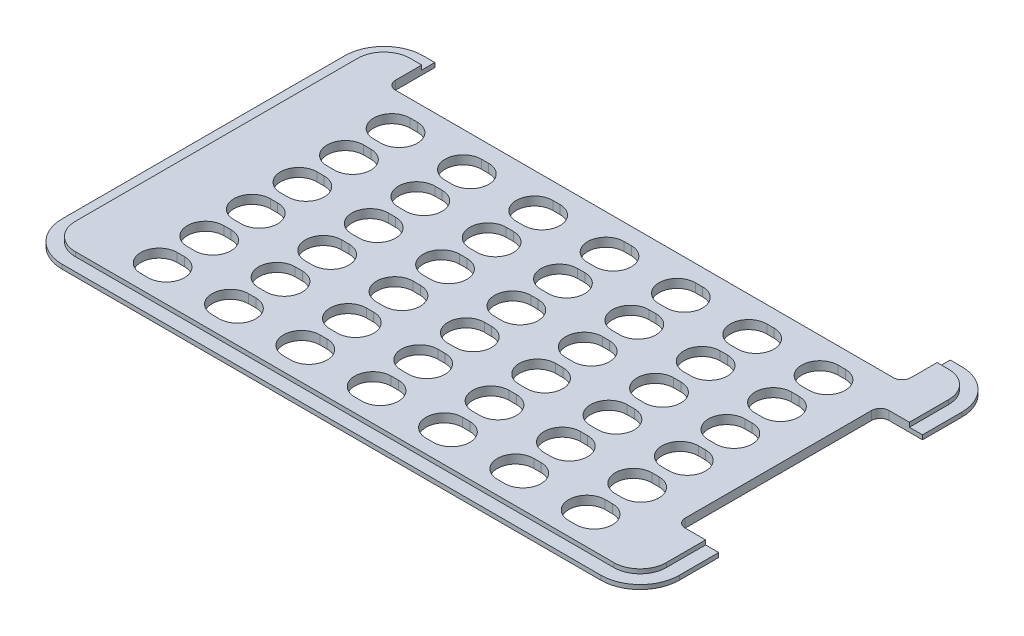
from build123d import *

# Parameters (mm, degrees)
SKETCH1_W                    = 212
SKETCH1_H                    = 124
OUTER_PROFILE_DEPTH          = 1.5
SKETCH2_W                    = 203
SKETCH2_H                    = 115
INNER_PROFILE_DEPTH          = 1.5
FILLET1_R                    = 9
FILLET2_R                    = 13.5
SKETCH4_W                    = 177
SKETCH4_H                    = 16.5
SKETCH4_W_2                  = 14.5
SKETCH4_H_2                  = 70
MESSAGE_BAR_DEPTH            = 123.837290755
CUTOUT_DEPTH                 = 123.837290755
CUTOUTS_COUNT                = 4
CUTOUTS_PITCH                = 24.5
CUTOUTS_COUNT_DIR2           = 6
CUTOUTS_PITCH_DIR2           = 16
MIRROR_CUTOUTS_COPY_1_DEPTH  = 123.837290755
MIRROR_CUTOUTS_COPY_2_DEPTH  = 123.837290755
MIRROR_CUTOUTS_COPY_3_DEPTH  = 123.837290755
MIRROR_CUTOUTS_COPY_4_DEPTH  = 123.837290755
MIRROR_CUTOUTS_COPY_5_DEPTH  = 123.837290755
MIRROR_CUTOUTS_COPY_6_DEPTH  = 123.837290755
MIRROR_CUTOUTS_COPY_7_DEPTH  = 123.837290755
MIRROR_CUTOUTS_COPY_8_DEPTH  = 123.837290755
MIRROR_CUTOUTS_COPY_9_DEPTH  = 123.837290755
MIRROR_CUTOUTS_COPY_10_DEPTH = 123.837290755
MIRROR_CUTOUTS_COPY_11_DEPTH = 123.837290755
MIRROR_CUTOUTS_COPY_12_DEPTH = 123.837290755
MIRROR_CUTOUTS_COPY_13_DEPTH = 123.837290755
MIRROR_CUTOUTS_COPY_14_DEPTH = 123.837290755
MIRROR_CUTOUTS_COPY_15_DEPTH = 123.837290755
MIRROR_CUTOUTS_COPY_16_DEPTH = 123.837290755
MIRROR_CUTOUTS_COPY_17_DEPTH = 123.837290755
MIRROR_CUTOUTS_COPY_18_DEPTH = 123.837290755
MIRROR_CUTOUTS_COPY_19_DEPTH = 123.837290755
MIRROR_CUTOUTS_COPY_20_DEPTH = 123.837290755
MIRROR_CUTOUTS_COPY_21_DEPTH = 123.837290755
MIRROR_CUTOUTS_COPY_22_DEPTH = 123.837290755
MIRROR_CUTOUTS_COPY_23_DEPTH = 123.837290755
MIRROR_CUTOUTS_COPY_24_DEPTH = 123.837290755
CORNER_RAD_R                 = 3


with BuildPart() as part:
    # Sketch1 → Outer Profile (new body)
    with BuildSketch(Plane(origin=(0, 0, 0), x_dir=(1, 0, 0), z_dir=(0, 1, 0))):
        Rectangle(SKETCH1_W, SKETCH1_H)
    extrude(amount=OUTER_PROFILE_DEPTH)

    # Sketch2 → Inner Profile (add)
    with BuildSketch(Plane(origin=(0, 1.5, 0), x_dir=(1, 0, 0), z_dir=(0, 1, 0))):
        Rectangle(SKETCH2_W, SKETCH2_H)
    extrude(amount=INNER_PROFILE_DEPTH)

    # Fillet1
    fillet1_edges = [part.edges().sort_by_distance(p)[0] for p in [
        (101.5, 2.25, 57.5),
        (101.5, 2.25, -57.5),
        (-101.5, 2.25, -57.5),
        (-101.5, 2.25, 57.5),
    ]]
    fillet(fillet1_edges, radius=FILLET1_R)

    # Fillet2
    fillet2_edges = [part.edges().sort_by_distance(p)[0] for p in [
        (-106, 0.75, -62),
        (106, 0.75, -62),
        (106, 0.75, 62),
        (-106, 0.75, 62),
    ]]
    fillet(fillet2_edges, radius=FILLET2_R)

    # Sketch4 → Message Bar (cut, through all)
    with BuildSketch(Plane(origin=(0, 3, 0), x_dir=(1, 0, 0), z_dir=(0, 1, 0))):
        with Locations((0, 53.75)):
            Rectangle(SKETCH4_W, SKETCH4_H)
        with Locations((98.75, 0)):
            Rectangle(SKETCH4_W_2, SKETCH4_H_2)
    extrude(amount=-MESSAGE_BAR_DEPTH, mode=Mode.SUBTRACT)

    # Sketch5 → Cutout (cut, through all)
    with BuildSketch(Plane(origin=(0, 3, 0), x_dir=(1, 0, 0), z_dir=(0, 1, 0))):
        with BuildLine():
            Line((-1.25, -40.25), (1.25, -40.25))
            ThreePointArc((1.25, -40.25), (7.5, -46.5), (1.25, -52.75))
            Line((1.25, -52.75), (-1.25, -52.75))
            ThreePointArc((-1.25, -52.75), (-7.5, -46.5), (-1.25, -40.25))
        make_face()
    cutout = extrude(amount=-CUTOUT_DEPTH, mode=Mode.SUBTRACT)

    # Cutouts: Cutout 4 × 6
    with Locations(*[(-i * CUTOUTS_PITCH, 0, -j * CUTOUTS_PITCH_DIR2) for i in range(CUTOUTS_COUNT) for j in range(CUTOUTS_COUNT_DIR2) if (i, j) != (0, 0)]):
        add(cutout, mode=Mode.SUBTRACT)

    # Mirror Cutouts copy 1 sketch → Mirror Cutouts copy 1 (cut, through all)
    with BuildSketch(Plane(origin=(0, 3, -16), x_dir=(-1, 0, 0), z_dir=(0, 1, 0))):
        with BuildLine():
            Line((-1.25, 40.25), (1.25, 40.25))
            ThreePointArc((1.25, 40.25), (7.5, 46.5), (1.25, 52.75))
            Line((1.25, 52.75), (-1.25, 52.75))
            ThreePointArc((-1.25, 52.75), (-7.5, 46.5), (-1.25, 40.25))
        make_face()
    extrude(amount=-MIRROR_CUTOUTS_COPY_1_DEPTH, mode=Mode.SUBTRACT)

    # Mirror Cutouts copy 2 sketch → Mirror Cutouts copy 2 (cut, through all)
    with BuildSketch(Plane(origin=(0, 3, -32), x_dir=(-1, 0, 0), z_dir=(0, 1, 0))):
        with BuildLine():
            Line((-1.25, 40.25), (1.25, 40.25))
            ThreePointArc((1.25, 40.25), (7.5, 46.5), (1.25, 52.75))
            Line((1.25, 52.75), (-1.25, 52.75))
            ThreePointArc((-1.25, 52.75), (-7.5, 46.5), (-1.25, 40.25))
        make_face()
    extrude(amount=-MIRROR_CUTOUTS_COPY_2_DEPTH, mode=Mode.SUBTRACT)

    # Mirror Cutouts copy 3 sketch → Mirror Cutouts copy 3 (cut, through all)
    with BuildSketch(Plane(origin=(0, 3, -48), x_dir=(-1, 0, 0), z_dir=(0, 1, 0))):
        with BuildLine():
            Line((-1.25, 40.25), (1.25, 40.25))
            ThreePointArc((1.25, 40.25), (7.5, 46.5), (1.25, 52.75))
            Line((1.25, 52.75), (-1.25, 52.75))
            ThreePointArc((-1.25, 52.75), (-7.5, 46.5), (-1.25, 40.25))
        make_face()
    extrude(amount=-MIRROR_CUTOUTS_COPY_3_DEPTH, mode=Mode.SUBTRACT)

    # Mirror Cutouts copy 4 sketch → Mirror Cutouts copy 4 (cut, through all)
    with BuildSketch(Plane(origin=(0, 3, -64), x_dir=(-1, 0, 0), z_dir=(0, 1, 0))):
        with BuildLine():
            Line((-1.25, 40.25), (1.25, 40.25))
            ThreePointArc((1.25, 40.25), (7.5, 46.5), (1.25, 52.75))
            Line((1.25, 52.75), (-1.25, 52.75))
            ThreePointArc((-1.25, 52.75), (-7.5, 46.5), (-1.25, 40.25))
        make_face()
    extrude(amount=-MIRROR_CUTOUTS_COPY_4_DEPTH, mode=Mode.SUBTRACT)

    # Mirror Cutouts copy 5 sketch → Mirror Cutouts copy 5 (cut, through all)
    with BuildSketch(Plane(origin=(0, 3, -80), x_dir=(-1, 0, 0), z_dir=(0, 1, 0))):
        with BuildLine():
            Line((-1.25, 40.25), (1.25, 40.25))
            ThreePointArc((1.25, 40.25), (7.5, 46.5), (1.25, 52.75))
            Line((1.25, 52.75), (-1.25, 52.75))
            ThreePointArc((-1.25, 52.75), (-7.5, 46.5), (-1.25, 40.25))
        make_face()
    extrude(amount=-MIRROR_CUTOUTS_COPY_5_DEPTH, mode=Mode.SUBTRACT)

    # Mirror Cutouts copy 6 sketch → Mirror Cutouts copy 6 (cut, through all)
    with BuildSketch(Plane(origin=(24.5, 3, 0), x_dir=(-1, 0, 0), z_dir=(0, 1, 0))):
        with BuildLine():
            Line((-1.25, 40.25), (1.25, 40.25))
            ThreePointArc((1.25, 40.25), (7.5, 46.5), (1.25, 52.75))
            Line((1.25, 52.75), (-1.25, 52.75))
            ThreePointArc((-1.25, 52.75), (-7.5, 46.5), (-1.25, 40.25))
        make_face()
    extrude(amount=-MIRROR_CUTOUTS_COPY_6_DEPTH, mode=Mode.SUBTRACT)

    # Mirror Cutouts copy 7 sketch → Mirror Cutouts copy 7 (cut, through all)
    with BuildSketch(Plane(origin=(24.5, 3, -16), x_dir=(-1, 0, 0), z_dir=(0, 1, 0))):
        with BuildLine():
            Line((-1.25, 40.25), (1.25, 40.25))
            ThreePointArc((1.25, 40.25), (7.5, 46.5), (1.25, 52.75))
            Line((1.25, 52.75), (-1.25, 52.75))
            ThreePointArc((-1.25, 52.75), (-7.5, 46.5), (-1.25, 40.25))
        make_face()
    extrude(amount=-MIRROR_CUTOUTS_COPY_7_DEPTH, mode=Mode.SUBTRACT)

    # Mirror Cutouts copy 8 sketch → Mirror Cutouts copy 8 (cut, through all)
    with BuildSketch(Plane(origin=(24.5, 3, -32), x_dir=(-1, 0, 0), z_dir=(0, 1, 0))):
        with BuildLine():
            Line((-1.25, 40.25), (1.25, 40.25))
            ThreePointArc((1.25, 40.25), (7.5, 46.5), (1.25, 52.75))
            Line((1.25, 52.75), (-1.25, 52.75))
            ThreePointArc((-1.25, 52.75), (-7.5, 46.5), (-1.25, 40.25))
        make_face()
    extrude(amount=-MIRROR_CUTOUTS_COPY_8_DEPTH, mode=Mode.SUBTRACT)

    # Mirror Cutouts copy 9 sketch → Mirror Cutouts copy 9 (cut, through all)
    with BuildSketch(Plane(origin=(24.5, 3, -48), x_dir=(-1, 0, 0), z_dir=(0, 1, 0))):
        with BuildLine():
            Line((-1.25, 40.25), (1.25, 40.25))
            ThreePointArc((1.25, 40.25), (7.5, 46.5), (1.25, 52.75))
            Line((1.25, 52.75), (-1.25, 52.75))
            ThreePointArc((-1.25, 52.75), (-7.5, 46.5), (-1.25, 40.25))
        make_face()
    extrude(amount=-MIRROR_CUTOUTS_COPY_9_DEPTH, mode=Mode.SUBTRACT)

    # Mirror Cutouts copy 10 sketch → Mirror Cutouts copy 10 (cut, through all)
    with BuildSketch(Plane(origin=(24.5, 3, -64), x_dir=(-1, 0, 0), z_dir=(0, 1, 0))):
        with BuildLine():
            Line((-1.25, 40.25), (1.25, 40.25))
            ThreePointArc((1.25, 40.25), (7.5, 46.5), (1.25, 52.75))
            Line((1.25, 52.75), (-1.25, 52.75))
            ThreePointArc((-1.25, 52.75), (-7.5, 46.5), (-1.25, 40.25))
        make_face()
    extrude(amount=-MIRROR_CUTOUTS_COPY_10_DEPTH, mode=Mode.SUBTRACT)

    # Mirror Cutouts copy 11 sketch → Mirror Cutouts copy 11 (cut, through all)
    with BuildSketch(Plane(origin=(24.5, 3, -80), x_dir=(-1, 0, 0), z_dir=(0, 1, 0))):
        with BuildLine():
            Line((-1.25, 40.25), (1.25, 40.25))
            ThreePointArc((1.25, 40.25), (7.5, 46.5), (1.25, 52.75))
            Line((1.25, 52.75), (-1.25, 52.75))
            ThreePointArc((-1.25, 52.75), (-7.5, 46.5), (-1.25, 40.25))
        make_face()
    extrude(amount=-MIRROR_CUTOUTS_COPY_11_DEPTH, mode=Mode.SUBTRACT)

    # Mirror Cutouts copy 12 sketch → Mirror Cutouts copy 12 (cut, through all)
    with BuildSketch(Plane(origin=(49, 3, 0), x_dir=(-1, 0, 0), z_dir=(0, 1, 0))):
        with BuildLine():
            Line((-1.25, 40.25), (1.25, 40.25))
            ThreePointArc((1.25, 40.25), (7.5, 46.5), (1.25, 52.75))
            Line((1.25, 52.75), (-1.25, 52.75))
            ThreePointArc((-1.25, 52.75), (-7.5, 46.5), (-1.25, 40.25))
        make_face()
    extrude(amount=-MIRROR_CUTOUTS_COPY_12_DEPTH, mode=Mode.SUBTRACT)

    # Mirror Cutouts copy 13 sketch → Mirror Cutouts copy 13 (cut, through all)
    with BuildSketch(Plane(origin=(49, 3, -16), x_dir=(-1, 0, 0), z_dir=(0, 1, 0))):
        with BuildLine():
            Line((-1.25, 40.25), (1.25, 40.25))
            ThreePointArc((1.25, 40.25), (7.5, 46.5), (1.25, 52.75))
            Line((1.25, 52.75), (-1.25, 52.75))
            ThreePointArc((-1.25, 52.75), (-7.5, 46.5), (-1.25, 40.25))
        make_face()
    extrude(amount=-MIRROR_CUTOUTS_COPY_13_DEPTH, mode=Mode.SUBTRACT)

    # Mirror Cutouts copy 14 sketch → Mirror Cutouts copy 14 (cut, through all)
    with BuildSketch(Plane(origin=(49, 3, -32), x_dir=(-1, 0, 0), z_dir=(0, 1, 0))):
        with BuildLine():
            Line((-1.25, 40.25), (1.25, 40.25))
            ThreePointArc((1.25, 40.25), (7.5, 46.5), (1.25, 52.75))
            Line((1.25, 52.75), (-1.25, 52.75))
            ThreePointArc((-1.25, 52.75), (-7.5, 46.5), (-1.25, 40.25))
        make_face()
    extrude(amount=-MIRROR_CUTOUTS_COPY_14_DEPTH, mode=Mode.SUBTRACT)

    # Mirror Cutouts copy 15 sketch → Mirror Cutouts copy 15 (cut, through all)
    with BuildSketch(Plane(origin=(49, 3, -48), x_dir=(-1, 0, 0), z_dir=(0, 1, 0))):
        with BuildLine():
            Line((-1.25, 40.25), (1.25, 40.25))
            ThreePointArc((1.25, 40.25), (7.5, 46.5), (1.25, 52.75))
            Line((1.25, 52.75), (-1.25, 52.75))
            ThreePointArc((-1.25, 52.75), (-7.5, 46.5), (-1.25, 40.25))
        make_face()
    extrude(amount=-MIRROR_CUTOUTS_COPY_15_DEPTH, mode=Mode.SUBTRACT)

    # Mirror Cutouts copy 16 sketch → Mirror Cutouts copy 16 (cut, through all)
    with BuildSketch(Plane(origin=(49, 3, -64), x_dir=(-1, 0, 0), z_dir=(0, 1, 0))):
        with BuildLine():
            Line((-1.25, 40.25), (1.25, 40.25))
            ThreePointArc((1.25, 40.25), (7.5, 46.5), (1.25, 52.75))
            Line((1.25, 52.75), (-1.25, 52.75))
            ThreePointArc((-1.25, 52.75), (-7.5, 46.5), (-1.25, 40.25))
        make_face()
    extrude(amount=-MIRROR_CUTOUTS_COPY_16_DEPTH, mode=Mode.SUBTRACT)

    # Mirror Cutouts copy 17 sketch → Mirror Cutouts copy 17 (cut, through all)
    with BuildSketch(Plane(origin=(49, 3, -80), x_dir=(-1, 0, 0), z_dir=(0, 1, 0))):
        with BuildLine():
            Line((-1.25, 40.25), (1.25, 40.25))
            ThreePointArc((1.25, 40.25), (7.5, 46.5), (1.25, 52.75))
            Line((1.25, 52.75), (-1.25, 52.75))
            ThreePointArc((-1.25, 52.75), (-7.5, 46.5), (-1.25, 40.25))
        make_face()
    extrude(amount=-MIRROR_CUTOUTS_COPY_17_DEPTH, mode=Mode.SUBTRACT)

    # Mirror Cutouts copy 18 sketch → Mirror Cutouts copy 18 (cut, through all)
    with BuildSketch(Plane(origin=(73.5, 3, 0), x_dir=(-1, 0, 0), z_dir=(0, 1, 0))):
        with BuildLine():
            Line((-1.25, 40.25), (1.25, 40.25))
            ThreePointArc((1.25, 40.25), (7.5, 46.5), (1.25, 52.75))
            Line((1.25, 52.75), (-1.25, 52.75))
            ThreePointArc((-1.25, 52.75), (-7.5, 46.5), (-1.25, 40.25))
        make_face()
    extrude(amount=-MIRROR_CUTOUTS_COPY_18_DEPTH, mode=Mode.SUBTRACT)

    # Mirror Cutouts copy 19 sketch → Mirror Cutouts copy 19 (cut, through all)
    with BuildSketch(Plane(origin=(73.5, 3, -16), x_dir=(-1, 0, 0), z_dir=(0, 1, 0))):
        with BuildLine():
            Line((-1.25, 40.25), (1.25, 40.25))
            ThreePointArc((1.25, 40.25), (7.5, 46.5), (1.25, 52.75))
            Line((1.25, 52.75), (-1.25, 52.75))
            ThreePointArc((-1.25, 52.75), (-7.5, 46.5), (-1.25, 40.25))
        make_face()
    extrude(amount=-MIRROR_CUTOUTS_COPY_19_DEPTH, mode=Mode.SUBTRACT)

    # Mirror Cutouts copy 20 sketch → Mirror Cutouts copy 20 (cut, through all)
    with BuildSketch(Plane(origin=(73.5, 3, -32), x_dir=(-1, 0, 0), z_dir=(0, 1, 0))):
        with BuildLine():
            Line((-1.25, 40.25), (1.25, 40.25))
            ThreePointArc((1.25, 40.25), (7.5, 46.5), (1.25, 52.75))
            Line((1.25, 52.75), (-1.25, 52.75))
            ThreePointArc((-1.25, 52.75), (-7.5, 46.5), (-1.25, 40.25))
        make_face()
    extrude(amount=-MIRROR_CUTOUTS_COPY_20_DEPTH, mode=Mode.SUBTRACT)

    # Mirror Cutouts copy 21 sketch → Mirror Cutouts copy 21 (cut, through all)
    with BuildSketch(Plane(origin=(73.5, 3, -48), x_dir=(-1, 0, 0), z_dir=(0, 1, 0))):
        with BuildLine():
            Line((-1.25, 40.25), (1.25, 40.25))
            ThreePointArc((1.25, 40.25), (7.5, 46.5), (1.25, 52.75))
            Line((1.25, 52.75), (-1.25, 52.75))
            ThreePointArc((-1.25, 52.75), (-7.5, 46.5), (-1.25, 40.25))
        make_face()
    extrude(amount=-MIRROR_CUTOUTS_COPY_21_DEPTH, mode=Mode.SUBTRACT)

    # Mirror Cutouts copy 22 sketch → Mirror Cutouts copy 22 (cut, through all)
    with BuildSketch(Plane(origin=(73.5, 3, -64), x_dir=(-1, 0, 0), z_dir=(0, 1, 0))):
        with BuildLine():
            Line((-1.25, 40.25), (1.25, 40.25))
            ThreePointArc((1.25, 40.25), (7.5, 46.5), (1.25, 52.75))
            Line((1.25, 52.75), (-1.25, 52.75))
            ThreePointArc((-1.25, 52.75), (-7.5, 46.5), (-1.25, 40.25))
        make_face()
    extrude(amount=-MIRROR_CUTOUTS_COPY_22_DEPTH, mode=Mode.SUBTRACT)

    # Mirror Cutouts copy 23 sketch → Mirror Cutouts copy 23 (cut, through all)
    with BuildSketch(Plane(origin=(73.5, 3, -80), x_dir=(-1, 0, 0), z_dir=(0, 1, 0))):
        with BuildLine():
            Line((-1.25, 40.25), (1.25, 40.25))
            ThreePointArc((1.25, 40.25), (7.5, 46.5), (1.25, 52.75))
            Line((1.25, 52.75), (-1.25, 52.75))
            ThreePointArc((-1.25, 52.75), (-7.5, 46.5), (-1.25, 40.25))
        make_face()
    extrude(amount=-MIRROR_CUTOUTS_COPY_23_DEPTH, mode=Mode.SUBTRACT)

    # Mirror Cutouts copy 24 sketch → Mirror Cutouts copy 24 (cut, through all)
    with BuildSketch(Plane(origin=(0, 3, 0), x_dir=(-1, 0, 0), z_dir=(0, 1, 0))):
        with BuildLine():
            Line((-1.25, 40.25), (1.25, 40.25))
            ThreePointArc((1.25, 40.25), (7.5, 46.5), (1.25, 52.75))
            Line((1.25, 52.75), (-1.25, 52.75))
            ThreePointArc((-1.25, 52.75), (-7.5, 46.5), (-1.25, 40.25))
        make_face()
    extrude(amount=-MIRROR_CUTOUTS_COPY_24_DEPTH, mode=Mode.SUBTRACT)

    # Corner Rad
    corner_rad_edges = [part.edges().sort_by_distance(p)[0] for p in [
        (88.5, 1.5, -45.5),
        (-88.5, 1.5, -45.5),
        (91.5, 1.5, 35),
        (91.5, 1.5, -35),
    ]]
    fillet(corner_rad_edges, radius=CORNER_RAD_R)


solid = part.part
